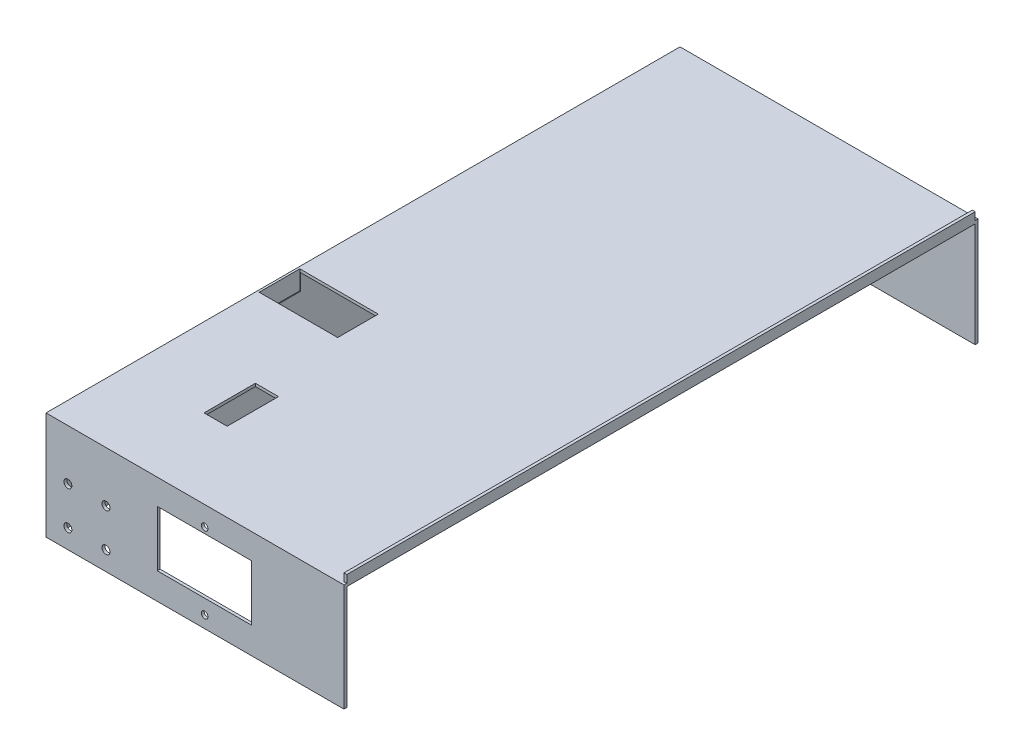
from build123d import *

# Parameters (mm, degrees)
SKETCH4_W            = 12.143179025
SKETCH4_H            = 26.975160708
BOSS_EXTRUDE4_DEPTH  = 1.5
SKETCH5_W            = 155
SKETCH5_H            = 56.5
BOSS_EXTRUDE5_DEPTH  = 1.5
SKETCH8_W            = 1.5
SKETCH8_H            = 330
BOSS_EXTRUDE14_DEPTH = 4
SKETCH7_W            = 155
SKETCH7_H            = 56.5
BOSS_EXTRUDE18_DEPTH = 1.5
SKETCH9_W            = 333
SKETCH9_H            = 56.5
BOSS_EXTRUDE19_DEPTH = 1.5
SKETCH15_R           = 2.1
CUT_EXTRUDE1_DEPTH   = 10
CUT_EXTRUDE2_START   = -10
SKETCH14_R           = 2.1
CUT_EXTRUDE2_DEPTH   = 10
CUT_EXTRUDE3_START   = -10
SKETCH12_R           = 2.1
CUT_EXTRUDE3_DEPTH   = 10
CUT_EXTRUDE4_START   = -10
SKETCH10_R           = 2.1
CUT_EXTRUDE4_DEPTH   = 10
CUT_EXTRUDE5_START   = -10
SKETCH11_R           = 2.1
CUT_EXTRUDE5_DEPTH   = 10
SKETCH17_W           = 41.213444594
SKETCH17_H           = 21.329304937
CUT_EXTRUDE6_DEPTH   = 10
SKETCH18_W           = 49.58132489
SKETCH18_H           = 29.319564564
CUT_EXTRUDE7_DEPTH   = 10
SKETCH19_R           = 1.75
CUT_EXTRUDE8_DEPTH   = 10


with BuildPart() as part:
    # Sketch4 → Boss-Extrude4 (new body)
    with BuildSketch(Plane(origin=(0, 0, 0), x_dir=(1, 0, 0), z_dir=(0, 1, 0))):
        Polygon((189.373653762, 330), (344.373653762, 330), (344.373653762, 0), (189.373653762, 0), (189.373653762, 65), (189.373653762, 130), align=None)
        with Locations((235.445243275, 53.487580354)):
            Rectangle(SKETCH4_W, SKETCH4_H, mode=Mode.SUBTRACT)
    extrude(amount=BOSS_EXTRUDE4_DEPTH)

    # Sketch5 → Boss-Extrude5 (add)
    with BuildSketch(Plane.XY):
        with Locations((266.873653762, -26.75)):
            Rectangle(SKETCH5_W, SKETCH5_H)
    extrude(amount=BOSS_EXTRUDE5_DEPTH)

    # Sketch8 → Boss-Extrude14 (add)
    with BuildSketch(Plane(origin=(0, 1.5, 0), x_dir=(1, 0, 0), z_dir=(0, 1, 0))):
        with Locations((343.623653762, 165)):
            Rectangle(SKETCH8_W, SKETCH8_H)
    extrude(amount=BOSS_EXTRUDE14_DEPTH)

    # Sketch7 → Boss-Extrude18 (add)
    with BuildSketch(Plane(origin=(0, 0, -330), x_dir=(-1, 0, 0), z_dir=(0, 0, -1))):
        with Locations((-266.873653762, -26.75)):
            Rectangle(SKETCH7_W, SKETCH7_H)
    extrude(amount=BOSS_EXTRUDE18_DEPTH)

    # Sketch9 → Boss-Extrude19 (add)
    with BuildSketch(Plane.ZY.offset(-189.373653762)):
        with Locations((-165, -26.75)):
            Rectangle(SKETCH9_W, SKETCH9_H)
    extrude(amount=BOSS_EXTRUDE19_DEPTH)

    # Sketch15 → Cut-Extrude1 (cut)
    with BuildSketch(Plane(origin=(0, 0, -331.5), x_dir=(-1, 0, 0), z_dir=(0, 0, -1))):
        with Locations((-219.373653762, -25)):
            Circle(SKETCH15_R)
        with Locations((-199.373653762, -25)):
            Circle(SKETCH15_R)
        with Locations((-219.373653762, -45)):
            Circle(SKETCH15_R)
        with Locations((-199.373653762, -45)):
            Circle(SKETCH15_R)
    extrude(amount=-CUT_EXTRUDE1_DEPTH, mode=Mode.SUBTRACT)

    # Sketch14 → Cut-Extrude2 (cut)
    with BuildSketch(Plane.XY.offset(1.5).offset(CUT_EXTRUDE2_START)):
        with Locations((219.373653762, -25)):
            Circle(SKETCH14_R)
    extrude(amount=CUT_EXTRUDE2_DEPTH, mode=Mode.SUBTRACT)

    # Sketch12 → Cut-Extrude3 (cut)
    with BuildSketch(Plane.XY.offset(1.5).offset(CUT_EXTRUDE3_START)):
        with Locations((199.373653762, -25)):
            Circle(SKETCH12_R)
    extrude(amount=CUT_EXTRUDE3_DEPTH, mode=Mode.SUBTRACT)

    # Sketch10 → Cut-Extrude4 (cut)
    with BuildSketch(Plane.XY.offset(1.5).offset(CUT_EXTRUDE4_START)):
        with Locations((219.373653762, -45)):
            Circle(SKETCH10_R)
    extrude(amount=CUT_EXTRUDE4_DEPTH, mode=Mode.SUBTRACT)

    # Sketch11 → Cut-Extrude5 (cut)
    with BuildSketch(Plane.XY.offset(1.5).offset(CUT_EXTRUDE5_START)):
        with Locations((199.373653762, -45)):
            Circle(SKETCH11_R)
    extrude(amount=CUT_EXTRUDE5_DEPTH, mode=Mode.SUBTRACT)

    # Sketch17 → Cut-Extrude6 (cut)
    with BuildSketch(Plane(origin=(0, 1.5, 0), x_dir=(1, 0, 0), z_dir=(0, 1, 0))):
        with Locations((209.585034006, 120.022925633)):
            Rectangle(SKETCH17_W, SKETCH17_H)
    extrude(amount=-CUT_EXTRUDE6_DEPTH, mode=Mode.SUBTRACT)

    # Sketch18 → Cut-Extrude7 (cut)
    with BuildSketch(Plane.XY.offset(1.5)):
        with Locations((271.095507036, -26.431235763)):
            Rectangle(SKETCH18_W, SKETCH18_H)
    extrude(amount=-CUT_EXTRUDE7_DEPTH, mode=Mode.SUBTRACT)

    # Sketch19 → Cut-Extrude8 (cut)
    with BuildSketch(Plane.XY.offset(1.5)):
        with Locations((271.196525088, -8.739077142)):
            Circle(SKETCH19_R)
        with Locations((271.196525088, -48.739077142)):
            Circle(SKETCH19_R)
    extrude(amount=-CUT_EXTRUDE8_DEPTH, mode=Mode.SUBTRACT)


solid = part.part
